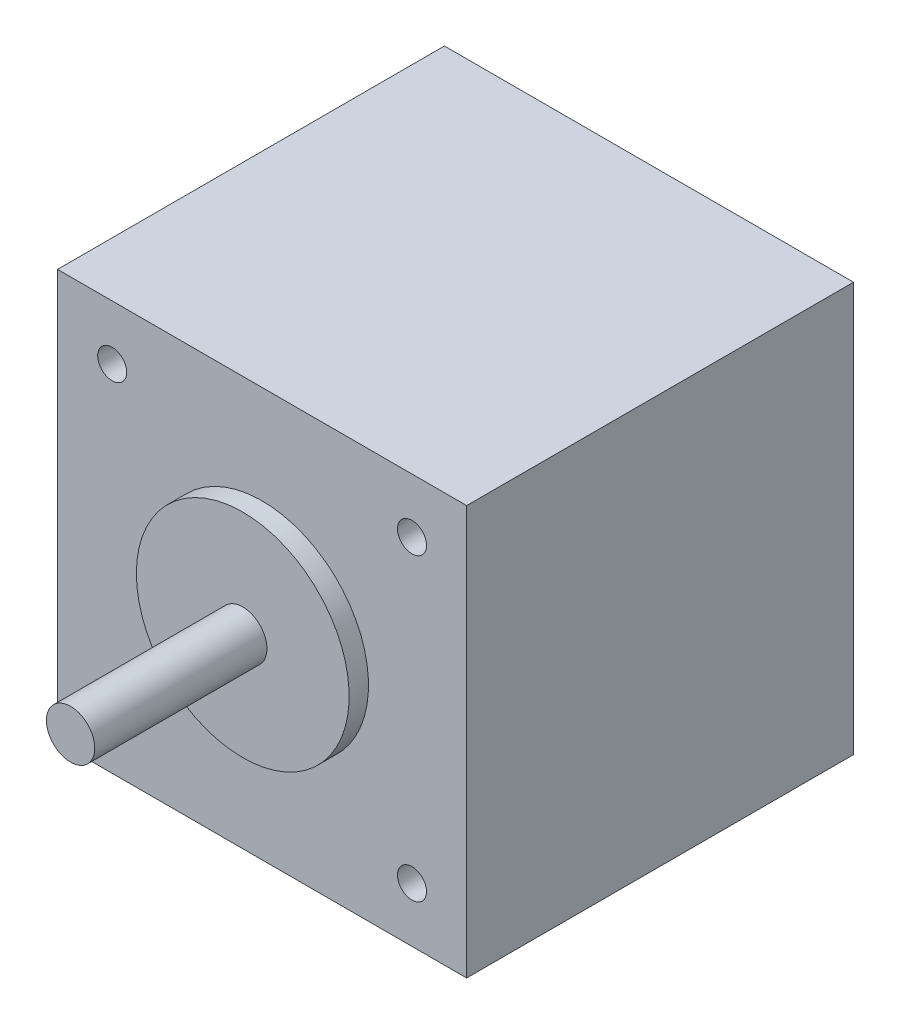
from build123d import *

# Parameters (mm, degrees)
SKETCH_1_W          = 42.3
SKETCH_1_H          = 42.3
EXTRUDE_1601_DEPTH  = 40
SKETCH_2_R          = 2.5
EXTRUDE_1647_DEPTH  = 59.8
SKETCH_3_R          = 11
EXTRUDE_1692_DEPTH  = 42
CUT_EXTRUDE_START   = 40
SKETCH_5_R          = 1.5
CUT_EXTRUDE_3_DEPTH = 4.5


with BuildPart() as part:
    # Эскиз1 → Extrude 1601 (new body)
    with BuildSketch(Plane.XY):
        Rectangle(SKETCH_1_W, SKETCH_1_H)
    extrude(amount=EXTRUDE_1601_DEPTH)

    # Эскиз2 → Extrude 1647 (add)
    with BuildSketch(Plane.XY):
        Circle(SKETCH_2_R)
    extrude(amount=EXTRUDE_1647_DEPTH)

    # Эскиз3 → Extrude 1692 (add)
    with BuildSketch(Plane.XY):
        Circle(SKETCH_3_R)
    extrude(amount=EXTRUDE_1692_DEPTH)

    # Эскиз5 → Крепеж_М3_ПРЕДВ (cut)
    with BuildSketch(Plane.XY.offset(CUT_EXTRUDE_START)):
        with Locations((-15.5, -15.5)):
            Circle(SKETCH_5_R)
        with Locations((-15.5, 15.5)):
            Circle(SKETCH_5_R)
        with Locations((15.5, -15.5)):
            Circle(SKETCH_5_R)
        with Locations((15.5, 15.5)):
            Circle(SKETCH_5_R)
    extrude(amount=-CUT_EXTRUDE_3_DEPTH, mode=Mode.SUBTRACT)


solid = part.part
